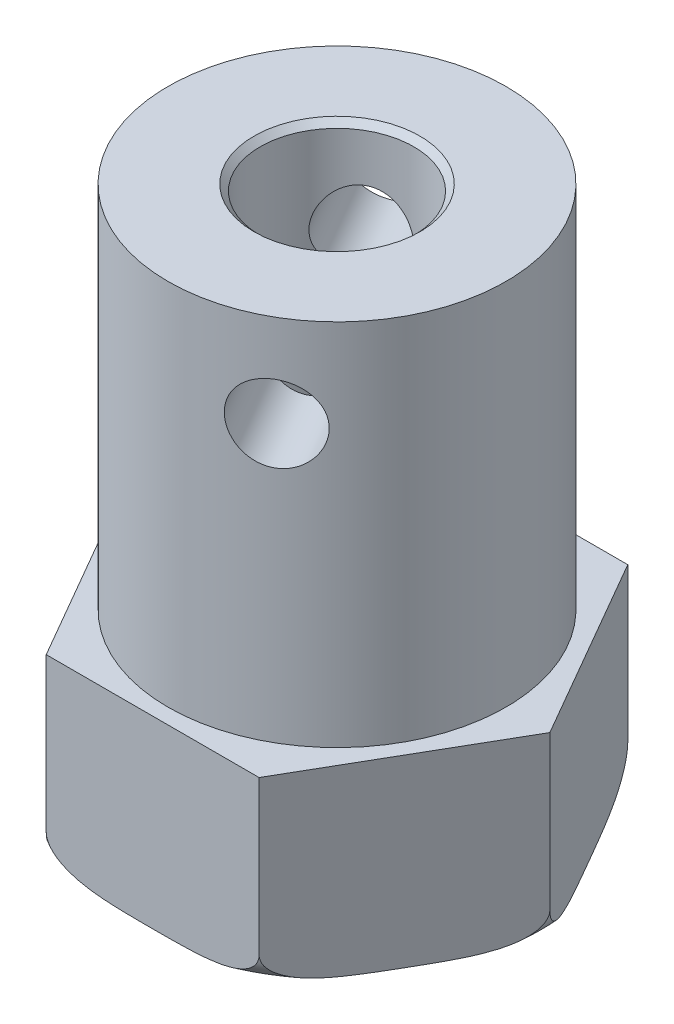
from build123d import *

# Parameters (mm, degrees)
BOSS_EXTRUDE1_DEPTH                              = 5
BOSS_EXTRUDE1_START                              = 0.002576877
BOSS_EXTRUDE1_3_OUTLINE_W                        = 16
BOSS_EXTRUDE1_3_OUTLINE_H                        = 16
BOSS_EXTRUDE1_3_DEPTH                            = 0.997423124
SKETCH2_W                                        = 5.5
SKETCH2_H                                        = 12
CBORE_FOR_M3_HEX_HEAD_MACHINE_SCREW1_D           = 3.3
CBORE_FOR_M3_HEX_HEAD_MACHINE_SCREW1_DEPTH       = 18.260356386
CBORE_FOR_M3_HEX_HEAD_MACHINE_SCREW1_CBORE_D     = 5
CBORE_FOR_M3_HEX_HEAD_MACHINE_SCREW1_CBORE_DEPTH = 13.5
F_2_5_2_5_DIAMETER_HOLE1_D                       = 2.5
F_2_5_2_5_DIAMETER_HOLE1_DEPTH                   = 14.334936491
CHAMFER1_SIZE                                    = 0.2
CHAMFER2_SIZE                                    = 0.35


with BuildPart() as part:
    # Boss-Extrude1: read off the stored shape, not the designer's step
    # Boss-Extrude1 outline → Boss-Extrude1 (new body)
    with BuildSketch(Plane(origin=(0, 1, 0), x_dir=(-1, 0, 0), z_dir=(0, 1, 0))):
        Polygon((3.464101615, 6), (-3.464101615, 6), (-6.92820323, 0), (-3.464101615, -6), (3.464101615, -6), (6.92820323, 0), align=None)
    extrude(amount=BOSS_EXTRUDE1_DEPTH)

    # Boss-Extrude1 2 outline → Boss-Extrude1 2 (revolve)
    with BuildSketch(Plane.XY):
        with BuildLine():
            Line((0, 1.000000001), (0, 0))
            Line((0, 0), (5.92820323, 0))
            ThreePointArc((5.92820323, 0), (6.635310012, 0.292893219), (6.92820323, 1.000000001))
            Line((6.92820323, 1.000000001), (0, 1.000000001))
        make_face()
    revolve(axis=Axis((0, 0, 0), (0, 1, 0)))

    # Boss-Extrude1 3 outline → Boss-Extrude1 3 (cut)
    with BuildSketch(Plane(origin=(0, 0, 0), x_dir=(1, 0, 0), z_dir=(0, 1, 0)).offset(BOSS_EXTRUDE1_START)):
        Rectangle(BOSS_EXTRUDE1_3_OUTLINE_W, BOSS_EXTRUDE1_3_OUTLINE_H)
        Polygon((6.92820323, 0), (3.464101615, -6), (-3.464101615, -6), (-6.92820323, 0), (-3.464101615, 6), (3.464101615, 6), align=None, mode=Mode.SUBTRACT)
    extrude(amount=BOSS_EXTRUDE1_3_DEPTH, mode=Mode.SUBTRACT)

    # Sketch2 → Revolve1 (revolve)
    with BuildSketch(Plane.XY, mode=Mode.PRIVATE) as revolve1_sk:
        with Locations((2.75, 12)):
            Rectangle(SKETCH2_W, SKETCH2_H)
    revolve(revolve1_sk.sketch.rotate(Axis((0, 18, 0), (0, -1, 0)), 270), axis=Axis((0, 18, 0), (0, -1, 0)))

    # CBORE for M3 Hex Head Machine Screw1
    with Locations(Plane(origin=(0, 18, 0), x_dir=(1, 0, 0), z_dir=(0, 1, 0))):
        with Locations((0, 0)):
            CounterBoreHole(CBORE_FOR_M3_HEX_HEAD_MACHINE_SCREW1_D / 2, CBORE_FOR_M3_HEX_HEAD_MACHINE_SCREW1_CBORE_D / 2, CBORE_FOR_M3_HEX_HEAD_MACHINE_SCREW1_CBORE_DEPTH, depth=CBORE_FOR_M3_HEX_HEAD_MACHINE_SCREW1_DEPTH)

    # Ø2.5 (2.5) Diameter Hole1
    with Locations(Plane(origin=(2.75, 15, 4.763139721), x_dir=(0.866025403784, 0, -0.5), z_dir=(0.5, 0, 0.866025403784))):
        with Locations((0, 0)):
            Hole(F_2_5_2_5_DIAMETER_HOLE1_D / 2, depth=F_2_5_2_5_DIAMETER_HOLE1_DEPTH)

    # Chamfer1
    chamfer1_edges = [part.edges().sort_by_distance(p)[0] for p in [
        (-2.5, 18, 0),
    ]]
    chamfer(chamfer1_edges, length=CHAMFER1_SIZE)

    # Chamfer2
    chamfer2_edges = [part.edges().sort_by_distance(p)[0] for p in [
        (1.65, 0, 0),
    ]]
    chamfer(chamfer2_edges, length=CHAMFER2_SIZE)


solid = part.part
